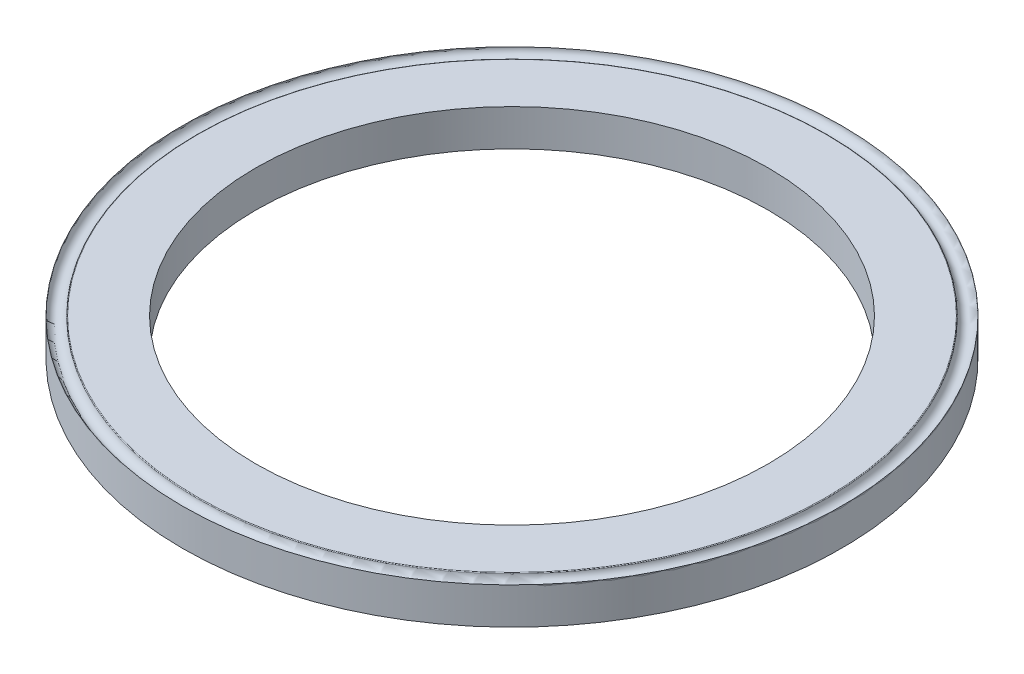
from build123d import *

# Parameters (mm, degrees)
TOP_SKETCH_R   = 4.5
TOP_SKETCH_R_2 = 3.5
TOP_DEPTH      = 0.25


with BuildPart() as part:
    # Top Sketch → Top (new, symmetric)
    with BuildSketch(Plane(origin=(0, 0, 0), x_dir=(1, 0, 0), z_dir=(0, 1, 0))):
        Circle(TOP_SKETCH_R)
        Circle(TOP_SKETCH_R_2, mode=Mode.SUBTRACT)
    extrude(amount=TOP_DEPTH, both=True)

    # Crimp Sketch → Crimp (revolve, cut)
    with BuildSketch(Plane.XY):
        with BuildLine():
            Line((-4.5, 0.25), (-4.290455488, 0.25))
            ThreePointArc((-4.290455488, 0.25), (-4.297197487, 0.247385489), (-4.30041408, 0.240909091))
            ThreePointArc((-4.30041408, 0.240909091), (-4.404550167, 0.150103574), (-4.5, 0.25))
        make_face()
    revolve(axis=Axis((0, 0.25, 0), (0, -1, 0)), mode=Mode.SUBTRACT)


solid = part.part
